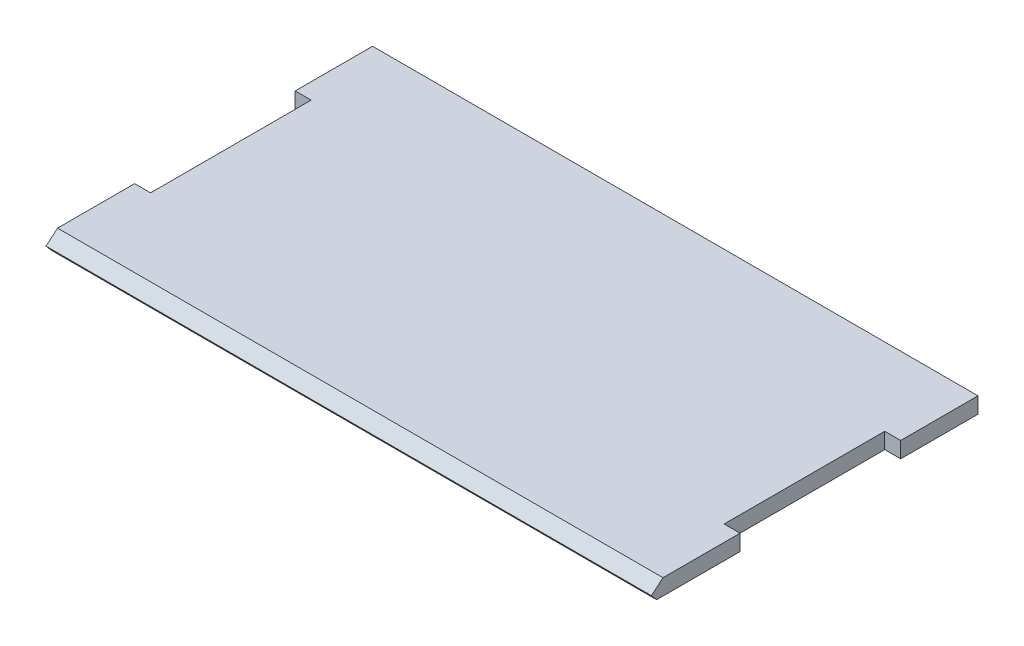
from build123d import *

# Parameters (mm, degrees)
BOSS_EXTRUDE1_START = -30.1625
BOSS_EXTRUDE1_DEPTH = 60.325
CUT_EXTRUDE3_REACH  = 45.791
SKETCH2_W           = 60.325
SKETCH2_H           = 6.35
SKETCH3_W           = 1.5875
SKETCH3_H           = 16.002
CUT_EXTRUDE4_DEPTH  = 45.394636066


# Read off the part's stored shape, not the designer's step: Boss-Extrude1
with BuildPart() as part:
    # Boss-Extrude1 outline → Boss-Extrude1 (new body)
    with BuildSketch(Plane.YZ.offset(BOSS_EXTRUDE1_START)):
        Polygon((-1.5875, 33.25479651), (-1.5875, 0), (0, 0), (0, 31.384816574), align=None)
    extrude(amount=BOSS_EXTRUDE1_DEPTH)

    # Sketch2 → Cut-Extrude3 (cut, up to next)
    with BuildSketch(Plane(origin=(0, 18.958587107, 9.052736266), x_dir=(1, 0, 0), z_dir=(0, 0.7623380888196845, 0.6471789847752716)), mode=Mode.PRIVATE) as cut_extrude3_sk1:
        with Locations((0, -33.979180387)):
            Rectangle(SKETCH2_W, SKETCH2_H)
    cut_extrude3_tool1 = extrude(cut_extrude3_sk1.sketch, amount=-CUT_EXTRUDE3_REACH, mode=Mode.PRIVATE) & part.part
    add(cut_extrude3_tool1.solids().sort_by_distance((0, -3.032024, 34.95636))[0], mode=Mode.SUBTRACT)

    # Sketch3 → Cut-Extrude4 (cut, through all)
    with BuildSketch(Plane(origin=(0, 0, 0), x_dir=(1, 0, 0), z_dir=(0, 1, 0))):
        with Locations((29.36875, -15.70482)):
            Rectangle(SKETCH3_W, SKETCH3_H)
        with Locations((-29.36875, -15.70482)):
            Rectangle(SKETCH3_W, SKETCH3_H)
    extrude(amount=-CUT_EXTRUDE4_DEPTH, mode=Mode.SUBTRACT)


solid = part.part
